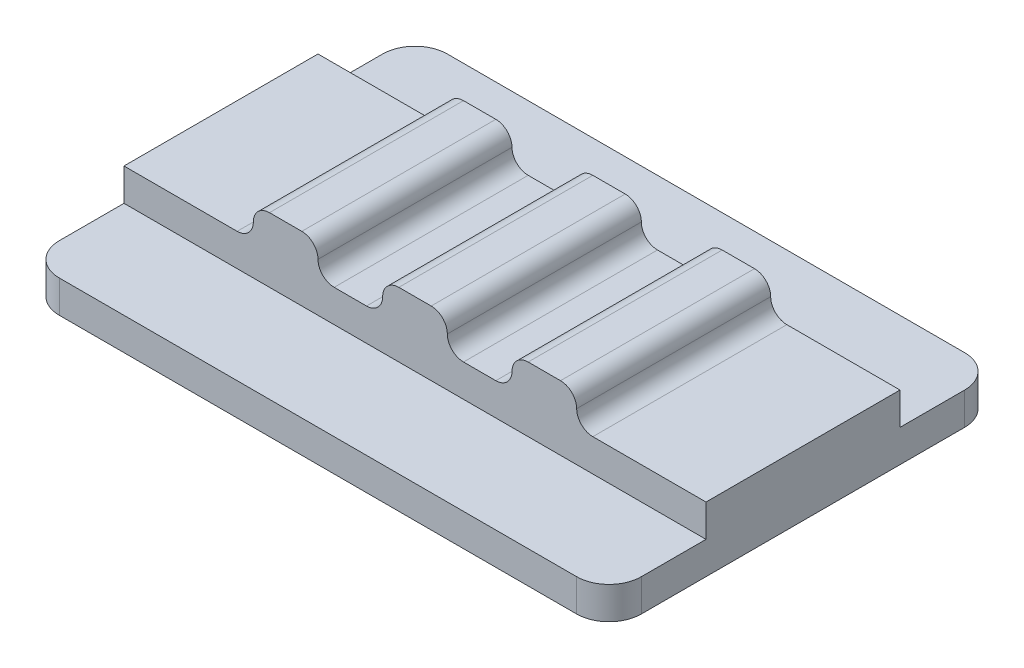
from build123d import *

# Parameters (mm, degrees)
SKETCH2_W           = 18
SKETCH2_H           = 12
BOSS_EXTRUDE1_DEPTH = 1
FILLET1_R           = 1
SKETCH3_W           = 18
SKETCH3_H           = 6
BOSS_EXTRUDE2_DEPTH = 1
SKETCH4_W           = 2
SKETCH4_H           = 6
BOSS_EXTRUDE3_DEPTH = 1
FILLET2_START       = -4
FILLET2_DEPTH       = 8
FILLET2_START_2     = -3
FILLET2_2_DEPTH     = 6


with BuildPart() as part:
    # Sketch2 → Boss-Extrude1 (new body)
    with BuildSketch(Plane(origin=(0, 0, 0), x_dir=(1, 0, 0), z_dir=(0, 1, 0))):
        Rectangle(SKETCH2_W, SKETCH2_H)
    extrude(amount=BOSS_EXTRUDE1_DEPTH)

    # Fillet1
    fillet1_edges = [part.edges().sort_by_distance(p)[0] for p in [
        (9, 0.5, 6),
        (-9, 0.5, 6),
        (-9, 0.5, -6),
        (9, 0.5, -6),
    ]]
    fillet(fillet1_edges, radius=FILLET1_R)

    # Sketch3 → Boss-Extrude2 (add)
    with BuildSketch(Plane(origin=(0, 1, 0), x_dir=(1, 0, 0), z_dir=(0, 1, 0))):
        Rectangle(SKETCH3_W, SKETCH3_H)
    extrude(amount=BOSS_EXTRUDE2_DEPTH)

    # Sketch4 → Boss-Extrude3 (add)
    with BuildSketch(Plane(origin=(0, 2, 0), x_dir=(1, 0, 0), z_dir=(0, 1, 0))):
        Rectangle(SKETCH4_W, SKETCH4_H)
        with Locations((-4, 0)):
            Rectangle(SKETCH4_W, SKETCH4_H)
        with Locations((4, 0)):
            Rectangle(SKETCH4_W, SKETCH4_H)
    extrude(amount=BOSS_EXTRUDE3_DEPTH)

    # Fillet2: read off the stored shape, not the designer's step
    # Fillet2 outline → Fillet2 (cut)
    with BuildSketch(Plane.XY.offset(FILLET2_START)):
        with BuildLine():
            ThreePointArc((-5, 2.5), (-4.853553391, 2.853553391), (-4.5, 3))
            Line((-4.5, 3), (-5, 3))
            Line((-5, 3), (-5, 2.5))
        make_face()
        with BuildLine():
            ThreePointArc((-3.5, 3), (-3.146446609, 2.853553391), (-3, 2.5))
            Line((-3, 2.5), (-3, 3))
            Line((-3, 3), (-3.5, 3))
        make_face()
        with BuildLine():
            ThreePointArc((-1, 2.5), (-0.853553391, 2.853553391), (-0.5, 3))
            Line((-0.5, 3), (-1, 3))
            Line((-1, 3), (-1, 2.5))
        make_face()
        with BuildLine():
            ThreePointArc((0.5, 3), (0.853553391, 2.853553391), (1, 2.5))
            Line((1, 2.5), (1, 3))
            Line((1, 3), (0.5, 3))
        make_face()
        with BuildLine():
            ThreePointArc((3, 2.5), (3.146446609, 2.853553391), (3.5, 3))
            Line((3.5, 3), (3, 3))
            Line((3, 3), (3, 2.5))
        make_face()
        with BuildLine():
            ThreePointArc((4.5, 3), (4.853553391, 2.853553391), (5, 2.5))
            Line((5, 2.5), (5, 3))
            Line((5, 3), (4.5, 3))
        make_face()
    extrude(amount=FILLET2_DEPTH, mode=Mode.SUBTRACT)

    # Fillet2 2 outline → Fillet2 2 (add)
    with BuildSketch(Plane.XY.offset(FILLET2_START_2)):
        with BuildLine():
            Line((-5, 2), (-5, 2.5))
            ThreePointArc((-5, 2.5), (-5.146446609, 2.146446609), (-5.5, 2))
            Line((-5.5, 2), (-5, 2))
        make_face()
        with BuildLine():
            Line((-3, 2), (-2.5, 2))
            ThreePointArc((-2.5, 2), (-2.853553391, 2.146446609), (-3, 2.5))
            Line((-3, 2.5), (-3, 2))
        make_face()
        with BuildLine():
            Line((-1, 2), (-1, 2.5))
            ThreePointArc((-1, 2.5), (-1.146446609, 2.146446609), (-1.5, 2))
            Line((-1.5, 2), (-1, 2))
        make_face()
        with BuildLine():
            Line((1, 2), (1.5, 2))
            ThreePointArc((1.5, 2), (1.146446609, 2.146446609), (1, 2.5))
            Line((1, 2.5), (1, 2))
        make_face()
        with BuildLine():
            Line((3, 2), (3, 2.5))
            ThreePointArc((3, 2.5), (2.853553391, 2.146446609), (2.5, 2))
            Line((2.5, 2), (3, 2))
        make_face()
        with BuildLine():
            ThreePointArc((5.5, 2), (5.146446609, 2.146446609), (5, 2.5))
            Line((5, 2.5), (5, 2))
            Line((5, 2), (5.5, 2))
        make_face()
    extrude(amount=FILLET2_2_DEPTH)


solid = part.part
